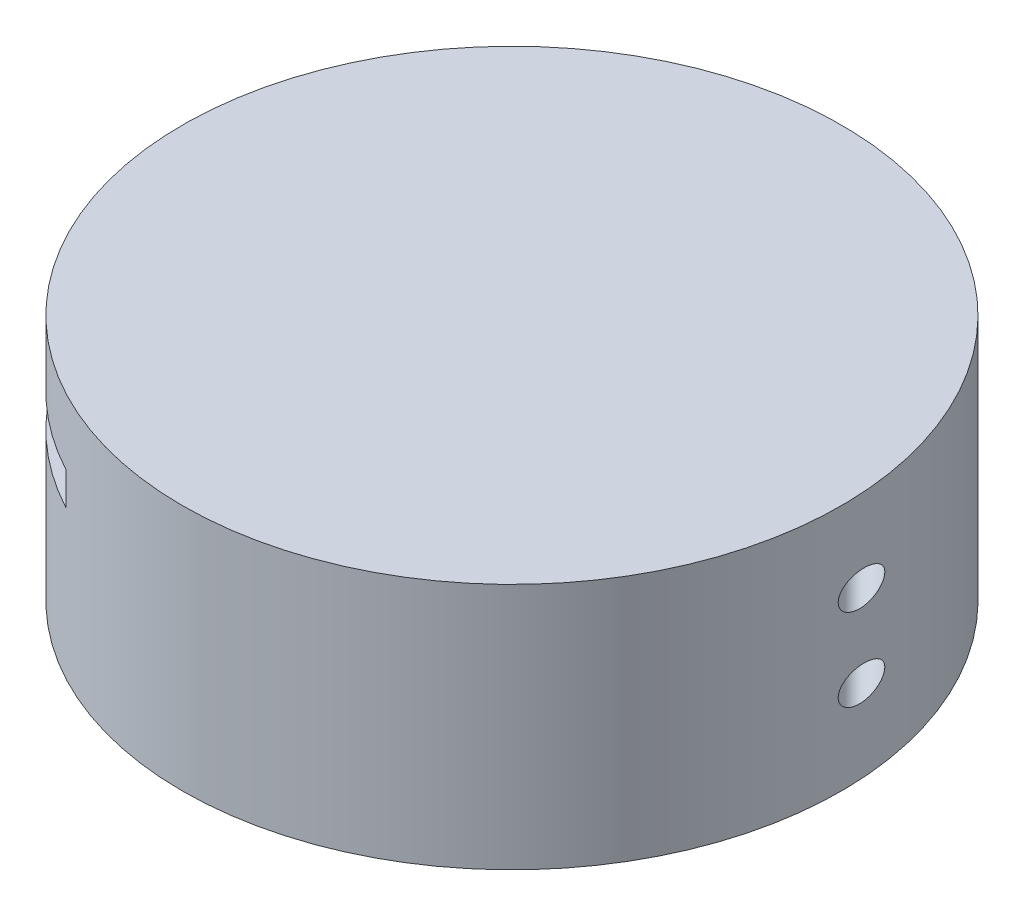
from build123d import *
from build123d.topology import SkipClean

# Parameters (mm, degrees)
SKETCH1_R               = 20
BOSS_EXTRUDE1_DEPTH     = 15
CUT_EXTRUDE1_DEPTH      = 6
CUT_EXTRUDE2_START      = 4
CUT_EXTRUDE2_DEPTH      = 4
CUT_SWEEP1_PROFILE_R    = 1
CUT_SWEEP2_PROFILE_R    = 1
CUT_EXTRUDE3_DEPTH      = 1
CUT_EXTRUDE3_DEPTH_BACK = 1


with BuildPart() as part:
    # Sketch1 → Boss-Extrude1 (new body)
    with BuildSketch(Plane(origin=(0, 0, 0), x_dir=(1, 0, 0), z_dir=(0, 1, 0))):
        Circle(SKETCH1_R)
    extrude(amount=BOSS_EXTRUDE1_DEPTH)

    # Sketch2 → Cut-Extrude1 (cut)
    with BuildSketch(Plane.XZ):
        with BuildLine():
            Line((-2.15, 1.516637572), (-2.15, -4.085684088))
            ThreePointArc((-2.15, -4.085684088), (0, -6.235684088), (2.15, -4.085684088))
            Line((2.15, -4.085684088), (2.15, 1.516637572))
            ThreePointArc((2.15, 1.516637572), (0, 7.435684088), (-2.15, 1.516637572))
        make_face()
    extrude(amount=-CUT_EXTRUDE1_DEPTH, mode=Mode.SUBTRACT)

    # Sketch3 → Cut-Extrude2 (cut)
    with SkipClean():  # the faces are left unmerged after this step: merging them gives an invalid solid
        with BuildSketch(Plane.XZ.offset(-6).offset(CUT_EXTRUDE2_START)):
            with BuildLine():
                Line((-3.35, -4.085684088), (-3.35, 4.085684088))
                ThreePointArc((-3.35, 4.085684088), (0, 7.435684088), (3.35, 4.085684088))
                Line((3.35, 4.085684088), (3.35, -4.085684088))
                ThreePointArc((3.35, -4.085684088), (0, -7.435684088), (-3.35, -4.085684088))
            make_face()
        extrude(amount=-CUT_EXTRUDE2_DEPTH, mode=Mode.SUBTRACT)

    # Cut-Sweep1: sweep along a path in Sketch6
    with SkipClean():  # the faces are left unmerged after this step: merging them gives an invalid solid
        with BuildLine(Plane(origin=(0, 10, 0), x_dir=(1, 0, 0), z_dir=(0, 1, 0))) as cut_sweep1_path:
            Line((32.713303623, -11.500100188), (10.606601718, 10.606601718))
            ThreePointArc((10.606601718, 10.606601718), (-5.740251485, 13.858192988), (-15, 0))
            Line((-15, 0), (-15, -54.761265519))
        # Cut-Sweep1 profile (on start of the path) → Cut-Sweep1 (sweep, cut)
        with BuildSketch(Plane(origin=(32.713303623, 10, 11.500100188), x_dir=(-0.7071067811865515, 0, 0.7071067811865437), z_dir=(-0.7071067811865437, 0, -0.7071067811865515))):
            Circle(CUT_SWEEP1_PROFILE_R)
        sweep(path=cut_sweep1_path.line, mode=Mode.SUBTRACT)

    # Cut-Sweep2: sweep along a path in Sketch5
    with SkipClean():  # the faces are left unmerged after this step: merging them gives an invalid solid
        with BuildLine(Plane(origin=(0, 5, 0), x_dir=(-1, 0, 0), z_dir=(0, -1, 0))) as cut_sweep2_path:
            Line((-32.713303623, -11.500100188), (-10.606601718, 10.606601718))
            ThreePointArc((-10.606601718, 10.606601718), (0, 15), (10.606601718, 10.606601718))
            Line((10.606601718, 10.606601718), (41.577001277, -20.363797841))
        # Cut-Sweep2 profile (on start of the path) → Cut-Sweep2 (sweep, cut)
        with BuildSketch(Plane(origin=(32.713303623, 5, 11.500100188), x_dir=(-0.7071067811865515, 0, 0.7071067811865437), z_dir=(-0.7071067811865437, 0, -0.7071067811865515))):
            Circle(CUT_SWEEP2_PROFILE_R)
        sweep(path=cut_sweep2_path.line, mode=Mode.SUBTRACT)

    # Sketch19 → Cut-Extrude3 (cut, two sides: drawn at the far end of the back side and taken through both)
    with SkipClean():  # the faces are left unmerged after this step: merging them gives an invalid solid
        with BuildSketch(Plane(origin=(0, 10, 0), x_dir=(1, 0, 0), z_dir=(0, 1, 0)).offset(-CUT_EXTRUDE3_DEPTH_BACK)):
            Polygon((-14.949747468, 5.870733518), (-14, 0), (-8.665269788, -20.660460329), (-22.201970025, -20.660460329), align=None)
        extrude(amount=CUT_EXTRUDE3_DEPTH + CUT_EXTRUDE3_DEPTH_BACK, mode=Mode.SUBTRACT)


solid = part.part
